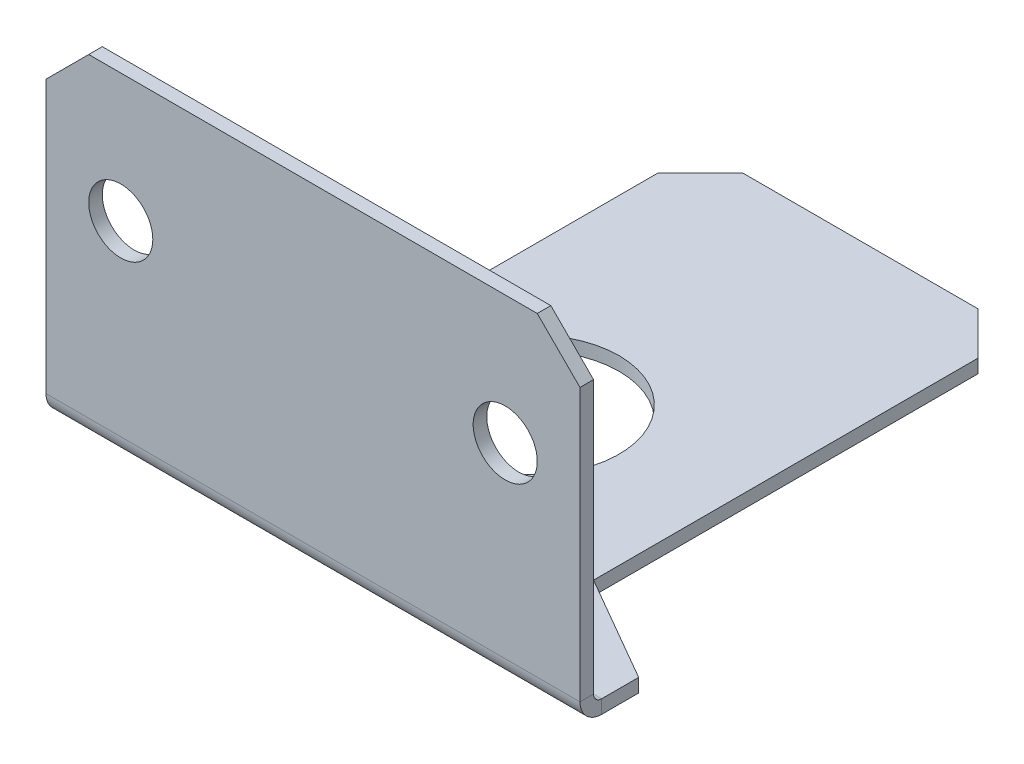
from build123d import *

# Parameters (mm, degrees)
BASE_FLANGE1_DEPTH        = 12.5
SKETCH7_R                 = 4
CUT_EXTRUDE1_DEPTH        = 10
SKETCH8_R                 = 1.5
CUT_EXTRUDE2_DEPTH        = 0.635
BREAK_CORNER1_START       = 11.66726189
BREAK_CORNER1_OUTLINE_W   = 6
BREAK_CORNER1_OUTLINE_H   = 3
BREAK_CORNER1_DEPTH       = 1.414213562
BREAK_CORNER1_START_2     = 21.566756826
BREAK_CORNER1_2_OUTLINE_W = 14
BREAK_CORNER1_2_OUTLINE_H = 3
BREAK_CORNER1_2_DEPTH     = 1.414213563
BREAK_CORNER1_START_3     = -22.980970389
BREAK_CORNER1_3_OUTLINE_W = 14
BREAK_CORNER1_3_OUTLINE_H = 3
BREAK_CORNER1_3_DEPTH     = 1.414213563
BREAK_CORNER1_START_4     = -13.081475452
BREAK_CORNER1_4_OUTLINE_W = 6
BREAK_CORNER1_4_OUTLINE_H = 3
BREAK_CORNER1_4_DEPTH     = 1.414213562


# Read off the part's stored shape, not the designer's step: Break-Corner1
# Sheet-metal steps are written as plain solids
with BuildPart() as part:
    # Sketch2 → Base-Flange1 (new, symmetric)
    with BuildSketch(Plane(origin=(0, 0, 0), x_dir=(0, 0, -1), z_dir=(1, 0, 0))):
        with BuildLine():
            Line((0, 6), (0, -8.749))
            ThreePointArc((0, -8.749), (0.111592316, -9.018407684), (0.381, -9.13))
            Line((0.381, -9.13), (25, -9.13))
            Line((25, -9.13), (25, -9.765))
            Line((25, -9.765), (0.381, -9.765))
            ThreePointArc((0.381, -9.765), (-0.33742049, -9.46742049), (-0.635, -8.749))
            Line((-0.635, -8.749), (-0.635, 6))
            Line((-0.635, 6), (0, 6))
        make_face()
    extrude(amount=BASE_FLANGE1_DEPTH, both=True)

    # Sketch7 → Cut-Extrude1 (cut)
    with BuildSketch(Plane.XZ.offset(9.765)):
        with Locations(Location((-1.007441433, -10.7, 0), (0, 0, 270))):
            Circle(SKETCH7_R)
        Polygon((7.5, -25), (7.5, -5), (12.5, -2.113248654), (12.5, -25), align=None)
        Polygon((-7.5, -25), (-7.5, -5), (-12.5, -2.113248654), (-12.5, -25), align=None)
    extrude(amount=-CUT_EXTRUDE1_DEPTH, mode=Mode.SUBTRACT)

    # Sketch8 → Cut-Extrude2 (cut)
    with BuildSketch(Plane.XY.offset(0.635)):
        with Locations((9, 0)):
            Circle(SKETCH8_R)
        with Locations((-9, 0)):
            Circle(SKETCH8_R)
    extrude(amount=-CUT_EXTRUDE2_DEPTH, mode=Mode.SUBTRACT)

    # Break-Corner1 outline → Break-Corner1 (cut)
    with BuildSketch(Plane(origin=(0, 0, 0), x_dir=(0.7071067811865474, -0.7071067811865477, 0), z_dir=(0.7071067811865476, 0.7071067811865476, 0)).offset(BREAK_CORNER1_START)):
        with Locations((5, -0.5)):
            Rectangle(BREAK_CORNER1_OUTLINE_W, BREAK_CORNER1_OUTLINE_H)
    extrude(amount=BREAK_CORNER1_DEPTH, mode=Mode.SUBTRACT)

    # Break-Corner1 2 outline → Break-Corner1 2 (cut)
    with BuildSketch(Plane(origin=(0, 0, 0), x_dir=(0.707106781186548, 0, 0.707106781186547), z_dir=(0.707106781186547, 0, -0.707106781186548)).offset(BREAK_CORNER1_START_2)):
        with Locations((-16, 9.5)):
            Rectangle(BREAK_CORNER1_2_OUTLINE_W, BREAK_CORNER1_2_OUTLINE_H)
    extrude(amount=BREAK_CORNER1_2_DEPTH, mode=Mode.SUBTRACT)

    # Break-Corner1 3 outline → Break-Corner1 3 (cut)
    with BuildSketch(Plane(origin=(0, 0, 0), x_dir=(0.7071067811865474, 0, -0.7071067811865477), z_dir=(0.7071067811865476, 0, 0.7071067811865476)).offset(BREAK_CORNER1_START_3)):
        with Locations((16, -9.5)):
            Rectangle(BREAK_CORNER1_3_OUTLINE_W, BREAK_CORNER1_3_OUTLINE_H)
    extrude(amount=BREAK_CORNER1_3_DEPTH, mode=Mode.SUBTRACT)

    # Break-Corner1 4 outline → Break-Corner1 4 (cut)
    with BuildSketch(Plane(origin=(0, 0, 0), x_dir=(0.707106781186548, 0.707106781186547, 0), z_dir=(0.707106781186547, -0.707106781186548, 0)).offset(BREAK_CORNER1_START_4)):
        with Locations((-5, 0.5)):
            Rectangle(BREAK_CORNER1_4_OUTLINE_W, BREAK_CORNER1_4_OUTLINE_H)
    extrude(amount=BREAK_CORNER1_4_DEPTH, mode=Mode.SUBTRACT)


solid = part.part
